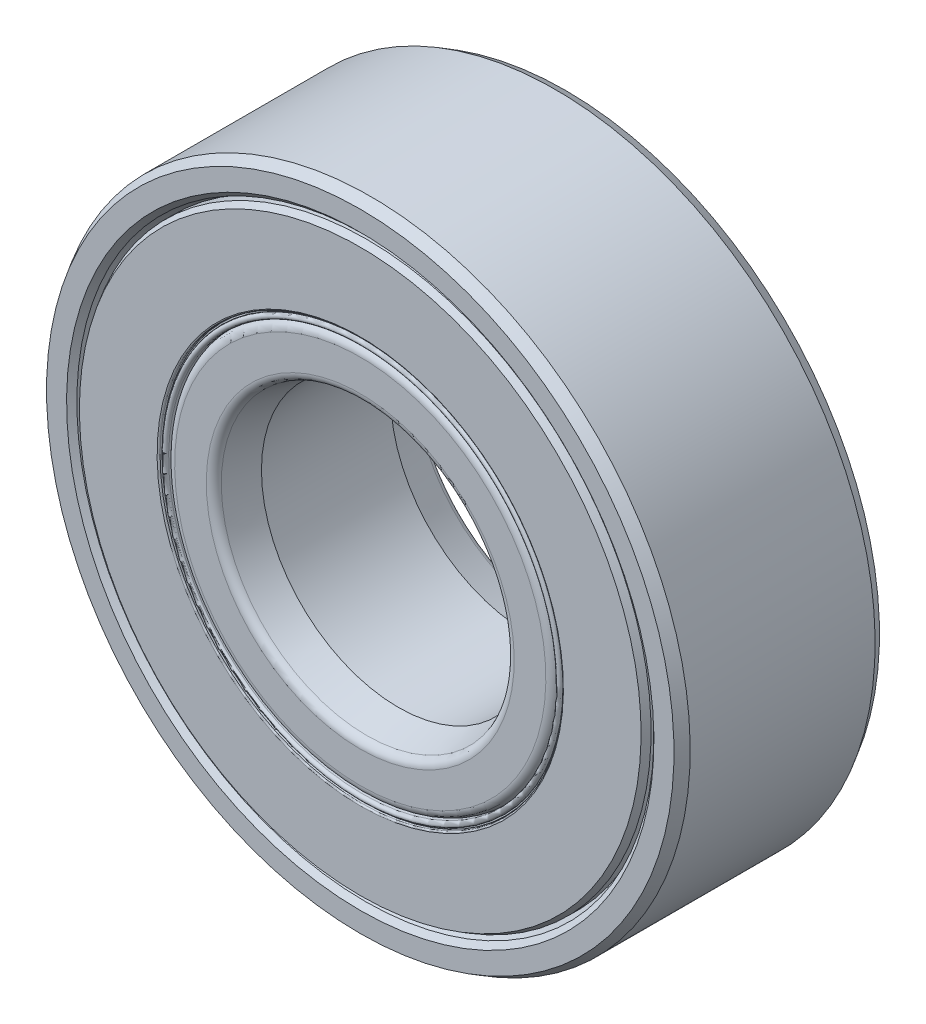
from build123d import *

# Parameters (mm, degrees)
CIRPATTERN1_COUNT = 8


with BuildPart() as part:
    # Sketch3 → Revolve1 (revolve)
    with BuildSketch(Plane(origin=(0, 0, 0), x_dir=(0, 0, -1), z_dir=(1, 0, 0))):
        with BuildLine():
            Line((-3.005710104, 9.890125), (-3.39328125, 10.031189361))
            Line((-3.39328125, 10.031189361), (-3.571875, 10.209783111))
            Line((-3.571875, 10.209783111), (-3.571875, 10.906277701))
            Line((-3.571875, 10.906277701), (-3.2146875, 11.1125))
            Line((-3.2146875, 11.1125), (3.2146875, 11.1125))
            Line((3.2146875, 11.1125), (3.571875, 10.906277701))
            Line((3.571875, 10.906277701), (3.571875, 10.209783111))
            Line((3.571875, 10.209783111), (3.39328125, 10.031189361))
            Line((3.39328125, 10.031189361), (3.005710104, 9.890125))
            Line((3.005710104, 9.890125), (1.793586198, 9.890125))
            ThreePointArc((1.793586198, 9.890125), (0, 10.705041667), (-1.793586198, 9.890125))
            Line((-1.793586198, 9.890125), (-3.005710104, 9.890125))
        make_face()
    revolve(axis=Axis((0, 0, 3.571875), (0, 0, -1)))


with BuildPart() as body_2:
    # Sketch4 → Revolve2 (revolve)
    with BuildSketch(Plane(origin=(0, 0, 0), x_dir=(0, 0, -1), z_dir=(1, 0, 0))):
        with BuildLine():
            Line((-2.244511682, 4.7625), (-3.345505546, 5.057510417))
            ThreePointArc((-3.345505546, 5.057510417), (-3.508761544, 5.166594587), (-3.571875, 5.352520833))
            Line((-3.571875, 5.352520833), (-3.571875, 6.452041076))
            ThreePointArc((-3.571875, 6.452041076), (-3.482420356, 6.66800369), (-3.266457743, 6.757458333))
            Line((-3.266457743, 6.757458333), (-1.793586198, 6.757458333))
            ThreePointArc((-1.793586198, 6.757458333), (0, 5.942541667), (1.793586198, 6.757458333))
            Line((1.793586198, 6.757458333), (3.266457743, 6.757458333))
            ThreePointArc((3.266457743, 6.757458333), (3.482420356, 6.66800369), (3.571875, 6.452041076))
            Line((3.571875, 6.452041076), (3.571875, 5.352520833))
            ThreePointArc((3.571875, 5.352520833), (3.508761544, 5.166594587), (3.345505546, 5.057510417))
            Line((3.345505546, 5.057510417), (2.244511682, 4.7625))
            Line((2.244511682, 4.7625), (-2.244511682, 4.7625))
        make_face()
    revolve(axis=Axis((0, 0, 3.571875), (0, 0, -1)))


with BuildPart() as body_3:
    # Sketch5 → Revolve3 (revolve)
    with BuildSketch(Plane(origin=(0, 0, 0), x_dir=(0, 0, -1), z_dir=(1, 0, 0))):
        with BuildLine():
            Line((-2.38125, 8.323791667), (2.38125, 8.323791667))
            ThreePointArc((2.38125, 8.323791667), (0, 10.705041667), (-2.38125, 8.323791667))
        make_face()
    revolve(axis=Axis((0, 8.323791667, 2.38125), (0, 0, -1)))


with BuildPart() as cirpattern1_1:
    # CirPattern1: pattern copy
    add(body_3.part.rotate(Axis((0, 0, 3.571875), (0, 0, -1)), 1 * 360 / CIRPATTERN1_COUNT))


with BuildPart() as cirpattern1_2:
    # CirPattern1: pattern copy
    add(body_3.part.rotate(Axis((0, 0, 3.571875), (0, 0, -1)), 2 * 360 / CIRPATTERN1_COUNT))


with BuildPart() as cirpattern1_3:
    # CirPattern1: pattern copy
    add(body_3.part.rotate(Axis((0, 0, 3.571875), (0, 0, -1)), 3 * 360 / CIRPATTERN1_COUNT))


with BuildPart() as cirpattern1_4:
    # CirPattern1: pattern copy
    add(body_3.part.rotate(Axis((0, 0, 3.571875), (0, 0, -1)), 4 * 360 / CIRPATTERN1_COUNT))


with BuildPart() as cirpattern1_5:
    # CirPattern1: pattern copy
    add(body_3.part.rotate(Axis((0, 0, 3.571875), (0, 0, -1)), 5 * 360 / CIRPATTERN1_COUNT))


with BuildPart() as cirpattern1_6:
    # CirPattern1: pattern copy
    add(body_3.part.rotate(Axis((0, 0, 3.571875), (0, 0, -1)), 6 * 360 / CIRPATTERN1_COUNT))


with BuildPart() as cirpattern1_7:
    # CirPattern1: pattern copy
    add(body_3.part.rotate(Axis((0, 0, 3.571875), (0, 0, -1)), 7 * 360 / CIRPATTERN1_COUNT))


with BuildPart() as body_11:
    # Sketch6 → Revolve4 (revolve)
    with BuildSketch(Plane(origin=(0, 0, 0), x_dir=(0, 0, -1), z_dir=(1, 0, 0))):
        with BuildLine():
            Line((-3.351904547, 9.890125), (-2.38125, 9.890125))
            Line((-2.38125, 9.890125), (-2.38125, 7.011458333))
            Line((-2.38125, 7.011458333), (-3.521075, 7.011458333))
            ThreePointArc((-3.521075, 7.011458333), (-3.556996024, 7.026337309), (-3.571875, 7.062258333))
            Line((-3.571875, 7.062258333), (-3.571875, 9.763125))
            Line((-3.571875, 9.763125), (-3.351904547, 9.890125))
        make_face()
        with BuildLine():
            Line((3.521075, 7.011458333), (2.38125, 7.011458333))
            Line((2.38125, 7.011458333), (2.38125, 9.890125))
            Line((2.38125, 9.890125), (3.351904547, 9.890125))
            Line((3.351904547, 9.890125), (3.571875, 9.763125))
            Line((3.571875, 9.763125), (3.571875, 7.062258333))
            ThreePointArc((3.571875, 7.062258333), (3.556996024, 7.026337309), (3.521075, 7.011458333))
        make_face()
    revolve(axis=Axis((0, 0, 3.571875), (0, 0, -1)))


with BuildPart() as body_12:
    # Sketch7 → Revolve5 (revolve)
    with BuildSketch(Plane(origin=(0, 0, 0), x_dir=(0, 0, -1), z_dir=(1, 0, 0))):
        with BuildLine():
            Line((-2.38125, 7.011458333), (-3.39368053, 7.011458333))
            Line((-3.39368053, 7.011458333), (-3.456215822, 7.000431674))
            ThreePointArc((-3.456215822, 7.000431674), (-3.47796189, 6.972091647), (-3.451625, 6.947958333))
            Line((-3.451625, 6.947958333), (-3.476625, 6.947958333))
            ThreePointArc((-3.476625, 6.947958333), (-3.571875, 6.852708333), (-3.476625, 6.757458333))
            Line((-3.476625, 6.757458333), (-2.38125, 6.757458333))
            Line((-2.38125, 6.757458333), (-2.38125, 7.011458333))
        make_face()
    revolve(axis=Axis((0, 0, 3.571875), (0, 0, -1)))


solid = Compound([part.part, body_2.part, body_3.part, cirpattern1_1.part, cirpattern1_2.part, cirpattern1_3.part, cirpattern1_4.part, cirpattern1_5.part, cirpattern1_6.part, cirpattern1_7.part, body_11.part, body_12.part])
